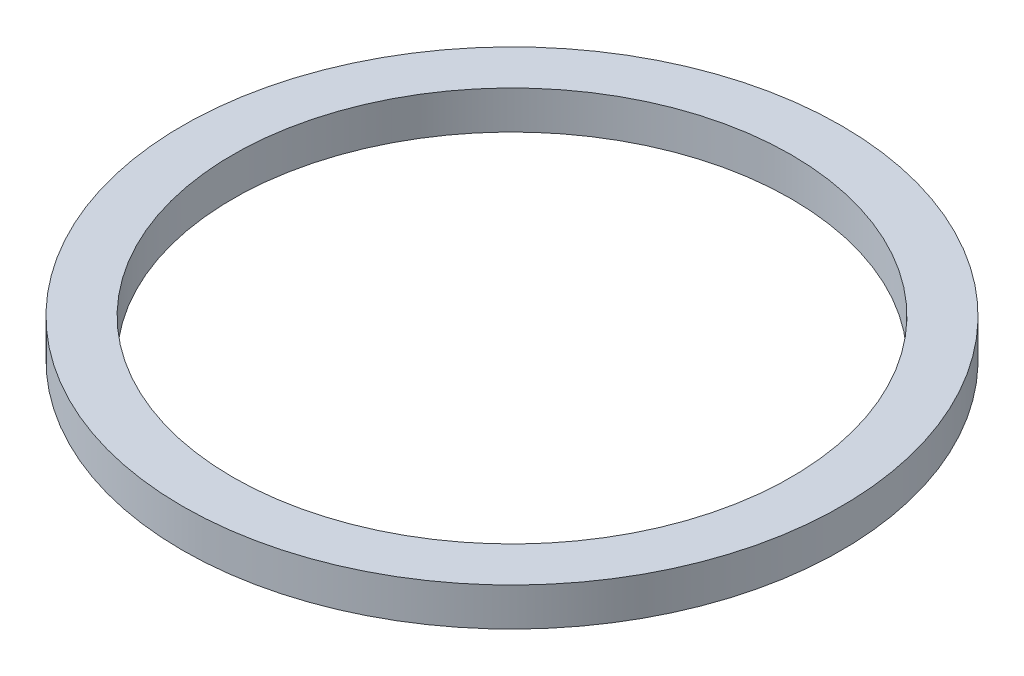
from build123d import *

# Parameters (mm, degrees)
SKETCH1_R           = 9.5
BOSS_EXTRUDE1_DEPTH = 1.1
SKETCH2_R           = 8.05
CUT_EXTRUDE1_DEPTH  = 14.479985163


with BuildPart() as part:
    # Sketch1 → Boss-Extrude1 (new body)
    with BuildSketch(Plane(origin=(0, 0, 0), x_dir=(1, 0, 0), z_dir=(0, 1, 0))):
        Circle(SKETCH1_R)
    extrude(amount=BOSS_EXTRUDE1_DEPTH)

    # Sketch2 → Cut-Extrude1 (cut, through all)
    with BuildSketch(Plane(origin=(0, 1.1, 0), x_dir=(1, 0, 0), z_dir=(0, 1, 0))):
        Circle(SKETCH2_R)
    extrude(amount=-CUT_EXTRUDE1_DEPTH, mode=Mode.SUBTRACT)


solid = part.part
